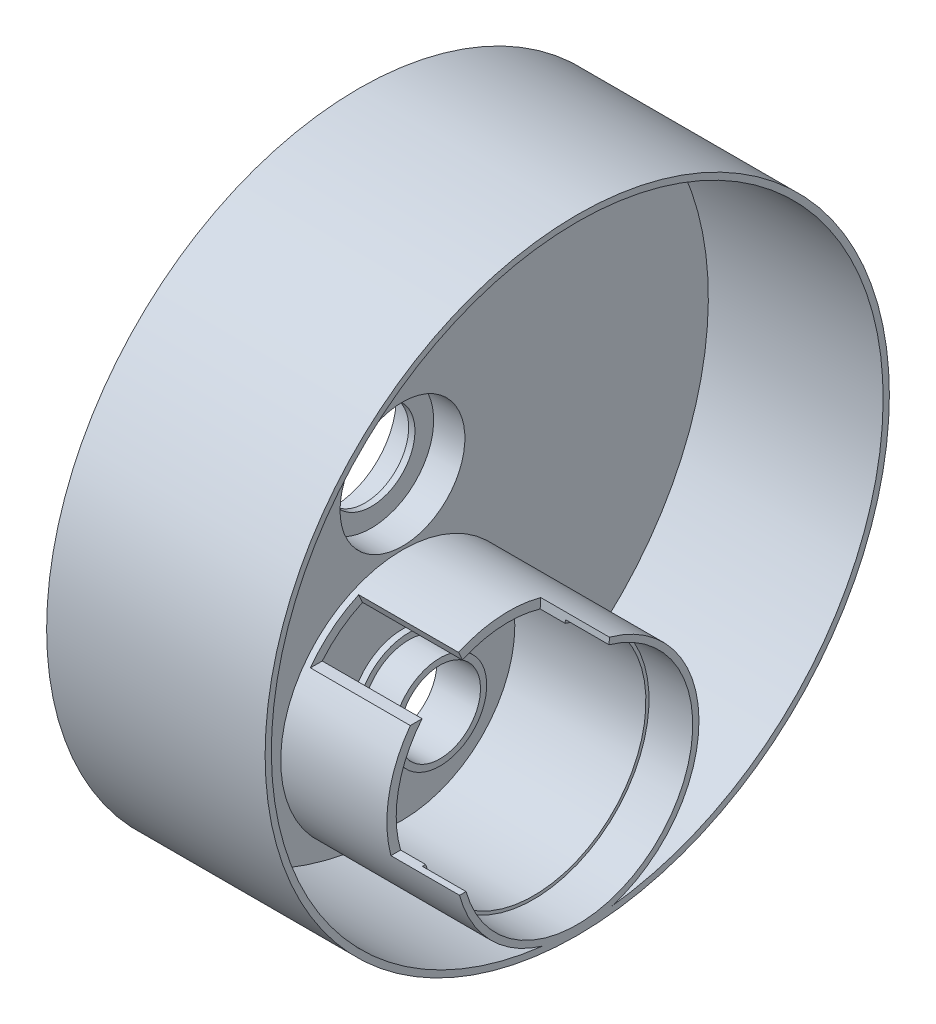
from build123d import *

# Parameters (mm, degrees)
CUT_EXTRUDE_START    = -11
CUT_EXTRUDE_1_DEPTH  = 11
CUT_EXTRUDE_2_DEPTH  = 27
EXTRUDE_START        = -1
SKETCH_4_R           = 50
SKETCH_4_R_2         = 10
SKETCH_4_R_3         = 6.5
EXTRUDE_1_DEPTH      = 1
EXTRUDE_2_DEPTH      = 6
EXTRUDE_2_DEPTH_BACK = 29
SKETCH_5_R           = 50
SKETCH_5_R_2         = 49


with BuildPart() as part:
    # Эскиз1 → Повернуть1 (revolve)
    with BuildSketch(Plane.XY):
        Polygon((-27, 7.5), (-27, 8.5), (-28, 8.5), (-28, 18), (-7, 18), (-7, 18.5), (0, 18.5), (0, 19.5), (-29, 19.5), (-29, 6.5), (-22, 6.5), (-22, 7.5), align=None)
    revolve(axis=Axis((0, 0, 0), (1, 0, 0)))

    # Эскиз2 → Вырез-Вытянуть1 (cut)
    with BuildSketch(Plane(origin=(0, 0, 0), x_dir=(0, 0, -1), z_dir=(1, 0, 0)).offset(CUT_EXTRUDE_START)):
        with BuildLine():
            Line((5.156251293, 18.805931846), (5, 16.248076809))
            ThreePointArc((5, 16.248076809), (-12.02081528, 12.02081528), (-16.248076809, -5))
            Line((-16.248076809, -5), (-18.848076825, -5))
            ThreePointArc((-18.848076825, -5), (-13.731246096, 13.845680938), (5.156251293, 18.805931846))
        make_face()
    extrude(amount=CUT_EXTRUDE_1_DEPTH, mode=Mode.SUBTRACT)

    # Эскиз3 → Вырез-Вытянуть2 (cut)
    with BuildSketch(Plane(origin=(0, 0, 0), x_dir=(0, 0, -1), z_dir=(1, 0, 0))):
        with BuildLine():
            Line((-40, 11.5), (-12.519984026, 11.5))
            ThreePointArc((-12.519984026, 11.5), (-9.954045186, 13.781037132), (-6.982120022, 15.5))
            Line((-6.982120022, 15.5), (-13.240816858, 29.394032278))
            Line((-13.240816858, 29.394032278), (-40, 11.5))
        make_face()
    extrude(amount=-CUT_EXTRUDE_2_DEPTH, mode=Mode.SUBTRACT)

    # Эскиз4 → Бобышка-Вытянуть1 (add)
    with BuildSketch(Plane.ZY.offset(29).offset(EXTRUDE_START)):
        with Locations((0, 30)):
            Circle(SKETCH_4_R)
        with Locations((0, 30)):
            Circle(SKETCH_4_R_2, mode=Mode.SUBTRACT)
        Circle(SKETCH_4_R_3, mode=Mode.SUBTRACT)
    extrude(amount=EXTRUDE_1_DEPTH)

    # Эскиз5 → Бобышка-Вытянуть2 (add, two sides: drawn at the far end of the back side and taken through both)
    with BuildSketch(Plane.ZY.offset(29).offset(-EXTRUDE_2_DEPTH_BACK)):
        with Locations((0, 30)):
            Circle(SKETCH_5_R)
        with Locations((0, 30)):
            Circle(SKETCH_5_R_2, mode=Mode.SUBTRACT)
    extrude(amount=EXTRUDE_2_DEPTH + EXTRUDE_2_DEPTH_BACK)

    # Эскиз9 → Повернуть2 (revolve)
    with BuildSketch(Plane.XY):
        Polygon((-39, 40), (-34, 40), (-34, 37), (-33, 37), (-33, 40), (-29, 40), (-29, 41), (-39, 41), align=None)
    revolve(axis=Axis((-50.347442598, 30, 0), (1, 0, 0)))


solid = part.part
